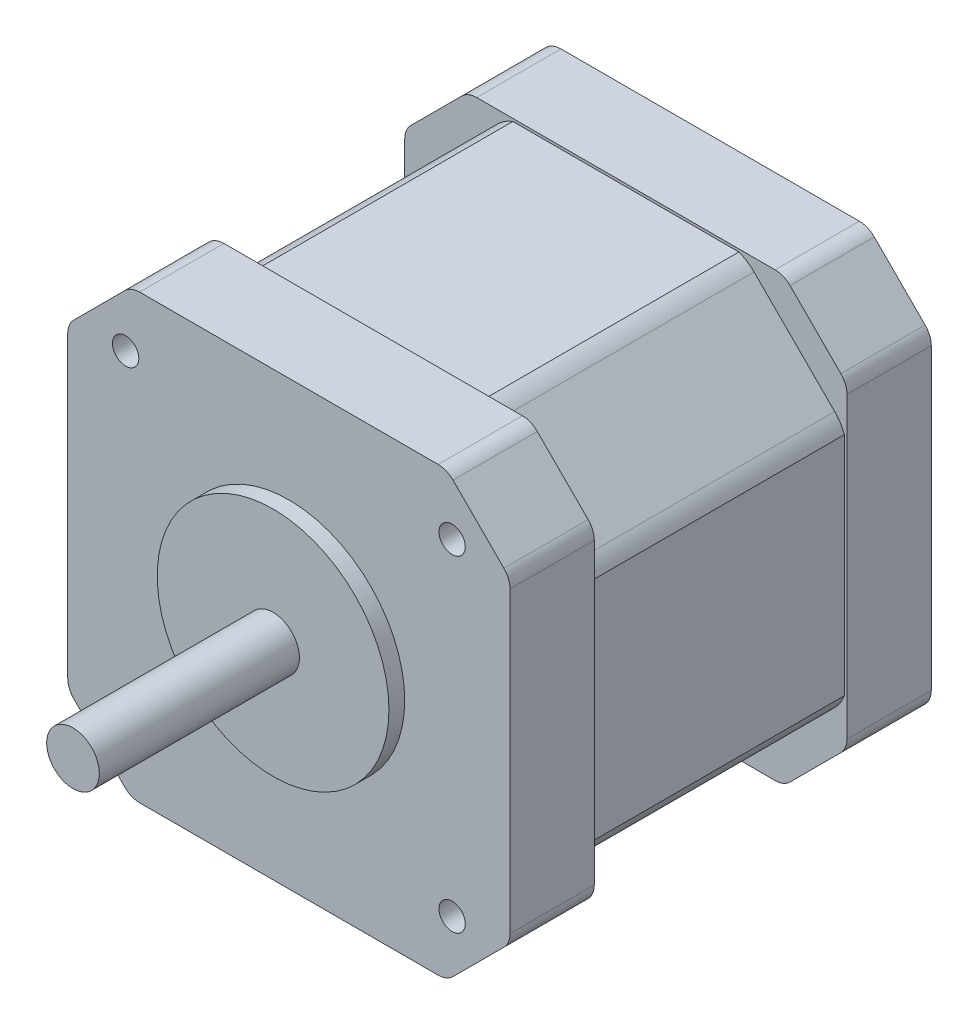
from build123d import *

# Parameters (mm, degrees)
EXTRUDE_START               = -40
EXTRUDE_2_DEPTH             = 40
EXTRUDE_START_2             = -8
EXTRUDE_2_2_DEPTH           = 8
EXTRUDE_2_3_DEPTH           = 8
EXTRUDE_2_4_OUTLINE_R       = 2.5
EXTRUDE_2_4_DEPTH           = 20.5
FILLET_1_R                  = 2
HOLE_WIZARD_2_5_2_5_1_D     = 2.5
HOLE_WIZARD_2_5_2_5_1_DEPTH = 6
HOLE_WIZARD_2_5_2_5_1_TIP   = 0.751075774
HOLE_WIZARD_2_5_2_5_2_D     = 2.5
HOLE_WIZARD_2_5_2_5_2_DEPTH = 6
HOLE_WIZARD_2_5_2_5_2_TIP   = 0.751075774
HOLE_WIZARD_2_5_2_5_3_D     = 2.5
HOLE_WIZARD_2_5_2_5_3_DEPTH = 6
HOLE_WIZARD_2_5_2_5_3_TIP   = 0.751075774
HOLE_WIZARD_2_5_2_5_4_D     = 2.5
HOLE_WIZARD_2_5_2_5_4_DEPTH = 6
HOLE_WIZARD_2_5_2_5_4_TIP   = 0.751075774
SKETCH_15_R                 = 11
SKETCH_15_R_2               = 2
EXTRUDE_3_DEPTH             = 1.5


with BuildPart() as part:
    # Бобышка-Вытянуть2: read off the stored shape, not the designer's step
    # Бобышка-Вытянуть2 outline → Бобышка-Вытянуть2 (new body)
    with BuildSketch(Plane.XY.offset(8).offset(EXTRUDE_START)):
        with BuildLine():
            ThreePointArc((19.828427125, -12.171572875), (20.366719307, -11.503053413), (20.75, -10.735086841))
            Line((20.75, -10.735086841), (20.75, 10.735086841))
            ThreePointArc((20.75, 10.735086841), (20.366719307, 11.503053413), (19.828427125, 12.171572875))
            Line((19.828427125, 12.171572875), (12.171572875, 19.828427125))
            ThreePointArc((12.171572875, 19.828427125), (11.503053413, 20.366719307), (10.735086841, 20.75))
            Line((10.735086841, 20.75), (-10.735086841, 20.75))
            ThreePointArc((-10.735086841, 20.75), (-11.503053413, 20.366719307), (-12.171572875, 19.828427125))
            Line((-12.171572875, 19.828427125), (-19.828427125, 12.171572875))
            ThreePointArc((-19.828427125, 12.171572875), (-20.366719307, 11.503053413), (-20.75, 10.735086841))
            Line((-20.75, 10.735086841), (-20.75, -10.735086841))
            ThreePointArc((-20.75, -10.735086841), (-20.366719307, -11.503053413), (-19.828427125, -12.171572875))
            Line((-19.828427125, -12.171572875), (-12.171572875, -19.828427125))
            ThreePointArc((-12.171572875, -19.828427125), (-11.503053413, -20.366719307), (-10.735086841, -20.75))
            Line((-10.735086841, -20.75), (10.735086841, -20.75))
            ThreePointArc((10.735086841, -20.75), (11.503053413, -20.366719307), (12.171572875, -19.828427125))
            Line((12.171572875, -19.828427125), (19.828427125, -12.171572875))
        make_face()
    extrude(amount=EXTRUDE_2_DEPTH)

    # Extrude 2 2 outline → Extrude 2 2 (add)
    with BuildSketch(Plane.XY.offset(8).offset(EXTRUDE_START_2)):
        Polygon((21, 15), (15, 21), (-15, 21), (-21, 15), (-21, -15), (-15, -21), (15, -21), (21, -15), align=None)
        with BuildLine():
            ThreePointArc((20.75, -10.735086841), (20.366719307, -11.503053413), (19.828427125, -12.171572875))
            Line((19.828427125, -12.171572875), (12.171572875, -19.828427125))
            ThreePointArc((12.171572875, -19.828427125), (11.503053413, -20.366719307), (10.735086841, -20.75))
            Line((10.735086841, -20.75), (-10.735086841, -20.75))
            ThreePointArc((-10.735086841, -20.75), (-11.503053413, -20.366719307), (-12.171572875, -19.828427125))
            Line((-12.171572875, -19.828427125), (-19.828427125, -12.171572875))
            ThreePointArc((-19.828427125, -12.171572875), (-20.366719307, -11.503053413), (-20.75, -10.735086841))
            Line((-20.75, -10.735086841), (-20.75, 10.735086841))
            ThreePointArc((-20.75, 10.735086841), (-20.366719307, 11.503053413), (-19.828427125, 12.171572875))
            Line((-19.828427125, 12.171572875), (-12.171572875, 19.828427125))
            ThreePointArc((-12.171572875, 19.828427125), (-11.503053413, 20.366719307), (-10.735086841, 20.75))
            Line((-10.735086841, 20.75), (10.735086841, 20.75))
            ThreePointArc((10.735086841, 20.75), (11.503053413, 20.366719307), (12.171572875, 19.828427125))
            Line((12.171572875, 19.828427125), (19.828427125, 12.171572875))
            ThreePointArc((19.828427125, 12.171572875), (20.366719307, 11.503053413), (20.75, 10.735086841))
            Line((20.75, 10.735086841), (20.75, -10.735086841))
        make_face(mode=Mode.SUBTRACT)
    extrude(amount=EXTRUDE_2_2_DEPTH)

    # Extrude 2 3 outline → Extrude 2 3 (add)
    with BuildSketch(Plane.XY.offset(8).offset(EXTRUDE_START)):
        with BuildLine():
            Line((21, -14.171572875), (21, 14.171572875))
            ThreePointArc((21, 14.171572875), (20.847759065, 14.93693974), (20.414213562, 15.585786438))
            Line((20.414213562, 15.585786438), (15.585786438, 20.414213562))
            ThreePointArc((15.585786438, 20.414213562), (14.93693974, 20.847759065), (14.171572875, 21))
            Line((14.171572875, 21), (-14.171572875, 21))
            ThreePointArc((-14.171572875, 21), (-14.93693974, 20.847759065), (-15.585786438, 20.414213562))
            Line((-15.585786438, 20.414213562), (-20.414213562, 15.585786438))
            ThreePointArc((-20.414213562, 15.585786438), (-20.847759065, 14.93693974), (-21, 14.171572875))
            Line((-21, 14.171572875), (-21, -14.171572875))
            ThreePointArc((-21, -14.171572875), (-20.847759065, -14.93693974), (-20.414213562, -15.585786438))
            Line((-20.414213562, -15.585786438), (-15.585786438, -20.414213562))
            ThreePointArc((-15.585786438, -20.414213562), (-14.93693974, -20.847759065), (-14.171572875, -21))
            Line((-14.171572875, -21), (14.171572875, -21))
            ThreePointArc((14.171572875, -21), (14.93693974, -20.847759065), (15.585786438, -20.414213562))
            Line((15.585786438, -20.414213562), (20.414213562, -15.585786438))
            ThreePointArc((20.414213562, -15.585786438), (20.847759065, -14.93693974), (21, -14.171572875))
        make_face()
        with BuildLine():
            Line((20.75, 10.735086841), (20.75, -10.735086841))
            ThreePointArc((20.75, -10.735086841), (20.366719307, -11.503053413), (19.828427125, -12.171572875))
            Line((19.828427125, -12.171572875), (12.171572875, -19.828427125))
            ThreePointArc((12.171572875, -19.828427125), (11.503053413, -20.366719307), (10.735086841, -20.75))
            Line((10.735086841, -20.75), (-10.735086841, -20.75))
            ThreePointArc((-10.735086841, -20.75), (-11.503053413, -20.366719307), (-12.171572875, -19.828427125))
            Line((-12.171572875, -19.828427125), (-19.828427125, -12.171572875))
            ThreePointArc((-19.828427125, -12.171572875), (-20.366719307, -11.503053413), (-20.75, -10.735086841))
            Line((-20.75, -10.735086841), (-20.75, 10.735086841))
            ThreePointArc((-20.75, 10.735086841), (-20.366719307, 11.503053413), (-19.828427125, 12.171572875))
            Line((-19.828427125, 12.171572875), (-12.171572875, 19.828427125))
            ThreePointArc((-12.171572875, 19.828427125), (-11.503053413, 20.366719307), (-10.735086841, 20.75))
            Line((-10.735086841, 20.75), (10.735086841, 20.75))
            ThreePointArc((10.735086841, 20.75), (11.503053413, 20.366719307), (12.171572875, 19.828427125))
            Line((12.171572875, 19.828427125), (19.828427125, 12.171572875))
            ThreePointArc((19.828427125, 12.171572875), (20.366719307, 11.503053413), (20.75, 10.735086841))
        make_face(mode=Mode.SUBTRACT)
    extrude(amount=EXTRUDE_2_3_DEPTH)

    # Extrude 2 4 outline → Extrude 2 4 (add)
    with BuildSketch(Plane.XY.offset(8)):
        Circle(EXTRUDE_2_4_OUTLINE_R)
    extrude(amount=EXTRUDE_2_4_DEPTH)

    # Скругление1
    fillet_1_edges = [part.edges().sort_by_distance(p)[0] for p in [
        (15, -21, 4),
        (-15, -21, 4),
        (-21, -15, 4),
        (15, 21, 4),
        (21, -15, 4),
        (-15, 21, 4),
        (21, 15, 4),
        (-21, 15, 4),
    ]]
    fillet(fillet_1_edges, radius=FILLET_1_R)

    # Диаметр отверстия Ø2.5 (2.5)1
    with Locations(Plane.XY.offset(8)):
        with Locations((-15.5, 15.5)):
            Hole(HOLE_WIZARD_2_5_2_5_1_D / 2, depth=HOLE_WIZARD_2_5_2_5_1_DEPTH)
            with Locations((0, 0, -(HOLE_WIZARD_2_5_2_5_1_DEPTH + HOLE_WIZARD_2_5_2_5_1_TIP / 2))):  # 118° drill point
                Cone(0, HOLE_WIZARD_2_5_2_5_1_D / 2, HOLE_WIZARD_2_5_2_5_1_TIP, mode=Mode.SUBTRACT)

    # Диаметр отверстия Ø2.5 (2.5)2
    with Locations(Plane.XY.offset(8)):
        with Locations((15.5, 15.5)):
            Hole(HOLE_WIZARD_2_5_2_5_2_D / 2, depth=HOLE_WIZARD_2_5_2_5_2_DEPTH)
            with Locations((0, 0, -(HOLE_WIZARD_2_5_2_5_2_DEPTH + HOLE_WIZARD_2_5_2_5_2_TIP / 2))):  # 118° drill point
                Cone(0, HOLE_WIZARD_2_5_2_5_2_D / 2, HOLE_WIZARD_2_5_2_5_2_TIP, mode=Mode.SUBTRACT)

    # Диаметр отверстия Ø2.5 (2.5)3
    with Locations(Plane.XY.offset(8)):
        with Locations((-15.5, -15.5)):
            Hole(HOLE_WIZARD_2_5_2_5_3_D / 2, depth=HOLE_WIZARD_2_5_2_5_3_DEPTH)
            with Locations((0, 0, -(HOLE_WIZARD_2_5_2_5_3_DEPTH + HOLE_WIZARD_2_5_2_5_3_TIP / 2))):  # 118° drill point
                Cone(0, HOLE_WIZARD_2_5_2_5_3_D / 2, HOLE_WIZARD_2_5_2_5_3_TIP, mode=Mode.SUBTRACT)

    # Диаметр отверстия Ø2.5 (2.5)4
    with Locations(Plane.XY.offset(8)):
        with Locations((15.5, -15.5)):
            Hole(HOLE_WIZARD_2_5_2_5_4_D / 2, depth=HOLE_WIZARD_2_5_2_5_4_DEPTH)
            with Locations((0, 0, -(HOLE_WIZARD_2_5_2_5_4_DEPTH + HOLE_WIZARD_2_5_2_5_4_TIP / 2))):  # 118° drill point
                Cone(0, HOLE_WIZARD_2_5_2_5_4_D / 2, HOLE_WIZARD_2_5_2_5_4_TIP, mode=Mode.SUBTRACT)

    # Эскиз15 → Бобышка-Вытянуть3 (add)
    with BuildSketch(Plane.XY.offset(8)):
        Circle(SKETCH_15_R)
        Circle(SKETCH_15_R_2, mode=Mode.SUBTRACT)
    extrude(amount=EXTRUDE_3_DEPTH)


solid = part.part
